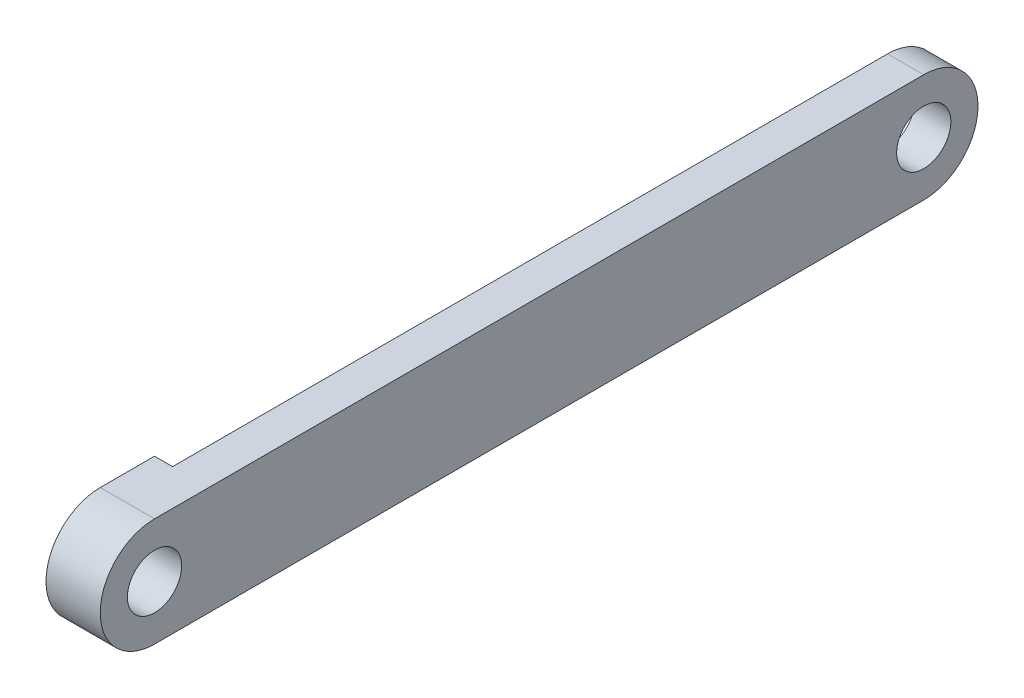
from build123d import *

# Parameters (mm, degrees)
SKETCH1_R           = 1.5
BOSS_EXTRUDE1_DEPTH = 3
SKETCH2_W           = 42.53
SKETCH2_H           = 6
CUT_EXTRUDE1_DEPTH  = 1


with BuildPart() as part:
    # Sketch1 → Boss-Extrude1 (new body)
    with BuildSketch(Plane(origin=(0, 0, 0), x_dir=(0, 0, -1), z_dir=(1, 0, 0))):
        with BuildLine():
            Line((0, -3), (42.53, -3))
            ThreePointArc((42.53, -3), (45.53, 0), (42.53, 3))
            Line((42.53, 3), (0, 3))
            ThreePointArc((0, 3), (-3, 0), (0, -3))
        make_face()
        Circle(SKETCH1_R, mode=Mode.SUBTRACT)
        with Locations((42.53, 0)):
            Circle(SKETCH1_R, mode=Mode.SUBTRACT)
    extrude(amount=BOSS_EXTRUDE1_DEPTH)

    # Sketch2 → Cut-Extrude1 (cut)
    with BuildSketch(Plane.ZY):
        with Locations((-24.265, 0)):
            Rectangle(SKETCH2_W, SKETCH2_H)
    extrude(amount=-CUT_EXTRUDE1_DEPTH, mode=Mode.SUBTRACT)


solid = part.part
